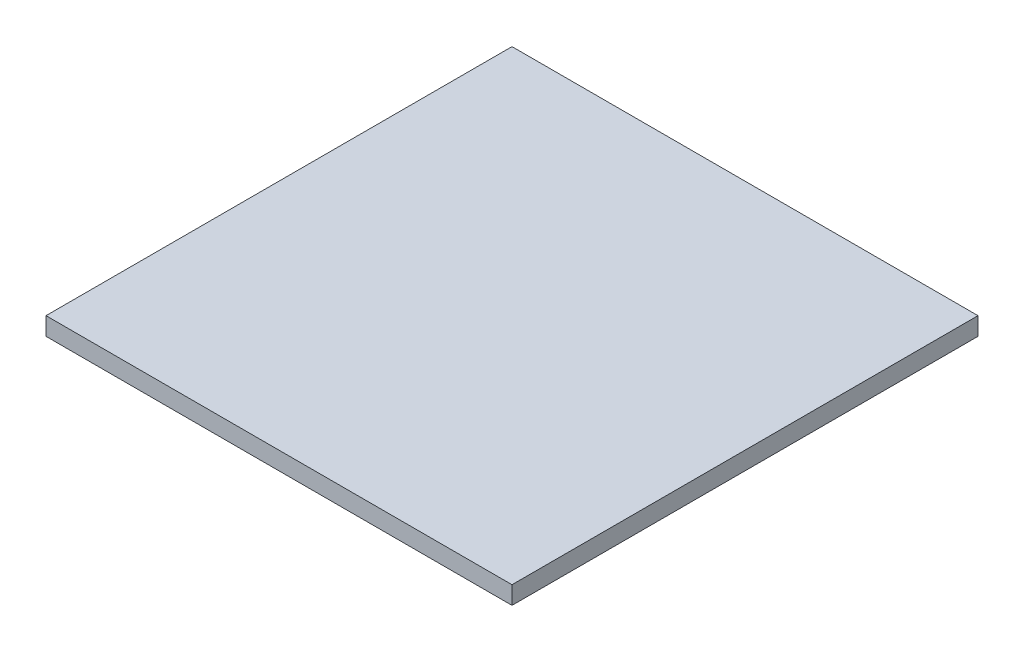
from build123d import *

# Parameters (mm, degrees)
SKETCH1_W           = 130
SKETCH1_H           = 130
BOSS_EXTRUDE1_DEPTH = 5


with BuildPart() as part:
    # Sketch1 → Boss-Extrude1 (new body)
    with BuildSketch(Plane(origin=(0, 0, 0), x_dir=(1, 0, 0), z_dir=(0, 1, 0))):
        Rectangle(SKETCH1_W, SKETCH1_H)
    extrude(amount=BOSS_EXTRUDE1_DEPTH)


solid = part.part
